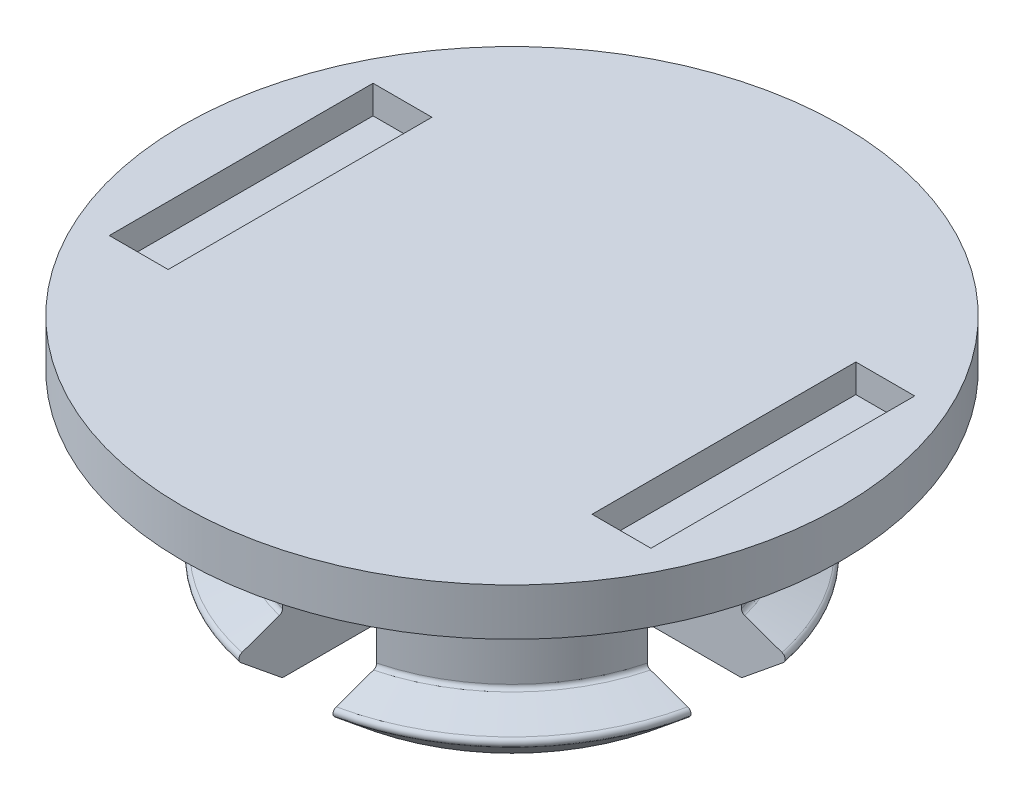
from build123d import *

# Parameters (mm, degrees)
SZKIC1_R                    = 7
DODANIE_WYCI_GNI_CIE1_DEPTH = 1
SZKIC2_R                    = 4
DODANIE_WYCI_GNI_CIE2_DEPTH = 4.22
ZAOKR_GLENIE1_R             = 0.1
WYTNIJ_WYCI_GNI_CIE1_DEPTH  = 4.22
SZKIC8_W                    = 1.25
SZKIC8_H                    = 5.6
WYTNIJ_WYCI_GNI_CIE2_DEPTH  = 0.6


with BuildPart() as part:
    # Szkic1 → Dodanie-wyciągnięcie1 (new body)
    with BuildSketch(Plane(origin=(0, 0, 0), x_dir=(1, 0, 0), z_dir=(0, 1, 0))):
        Circle(SZKIC1_R)
    extrude(amount=DODANIE_WYCI_GNI_CIE1_DEPTH)

    # Szkic2 → Dodanie-wyciągnięcie2 (add)
    with BuildSketch(Plane(origin=(0, 0, 0), x_dir=(-1, 0, 0), z_dir=(0, -1, 0))):
        Circle(SZKIC2_R)
    extrude(amount=DODANIE_WYCI_GNI_CIE2_DEPTH)

    # Szkic3 → Obrót1 (revolve)
    with BuildSketch(Plane(origin=(0, 0, 0), x_dir=(0, 0, -1), z_dir=(1, 0, 0))):
        Polygon((4, -4.22), (5, -3.383970234), (4, -3.02), align=None)
    revolve(axis=Axis((0, -4.22, 0), (0, 1, 0)))

    # Zaokrąglenie1
    zaokr_glenie1_edges = [part.edges().sort_by_distance(p)[0] for p in [
        (0, -3.383970234, 5),
        (2.828427125, -3.02, 2.828427125),
        (0, -4.22, 4),
    ]]
    fillet(zaokr_glenie1_edges, radius=ZAOKR_GLENIE1_R)

    # Szkic5 → Wytnij-wyciągnięcie1 (cut)
    with BuildSketch(Plane(origin=(0, -4.22, 0), x_dir=(-1, 0, 0), z_dir=(0, -1, 0))):
        with BuildLine():
            Line((-7.794060286, -1), (-1, -1))
            Line((-1, -1), (-1, -7.794060286))
            ThreePointArc((-1, -7.794060286), (0, -7.857949844), (1, -7.794060286))
            Line((1, -7.794060286), (1, -1))
            Line((1, -1), (7.794060286, -1))
            ThreePointArc((7.794060286, -1), (7.857949844, 0), (7.794060286, 1))
            Line((7.794060286, 1), (1, 1))
            Line((1, 1), (1, 7.794060286))
            ThreePointArc((1, 7.794060286), (0, 7.857949844), (-1, 7.794060286))
            Line((-1, 7.794060286), (-1, 1))
            Line((-1, 1), (-7.794060286, 1))
            ThreePointArc((-7.794060286, 1), (-7.857949844, 0), (-7.794060286, -1))
        make_face()
    extrude(amount=-WYTNIJ_WYCI_GNI_CIE1_DEPTH, mode=Mode.SUBTRACT)

    # Szkic8 → Wytnij-wyciągnięcie2 (cut)
    with BuildSketch(Plane(origin=(0, 1, 0), x_dir=(1, 0, 0), z_dir=(0, 1, 0))):
        with Locations((5.125, 0)):
            Rectangle(SZKIC8_W, SZKIC8_H)
        with Locations((-5.125, 0)):
            Rectangle(SZKIC8_W, SZKIC8_H)
    extrude(amount=-WYTNIJ_WYCI_GNI_CIE2_DEPTH, mode=Mode.SUBTRACT)


solid = part.part
